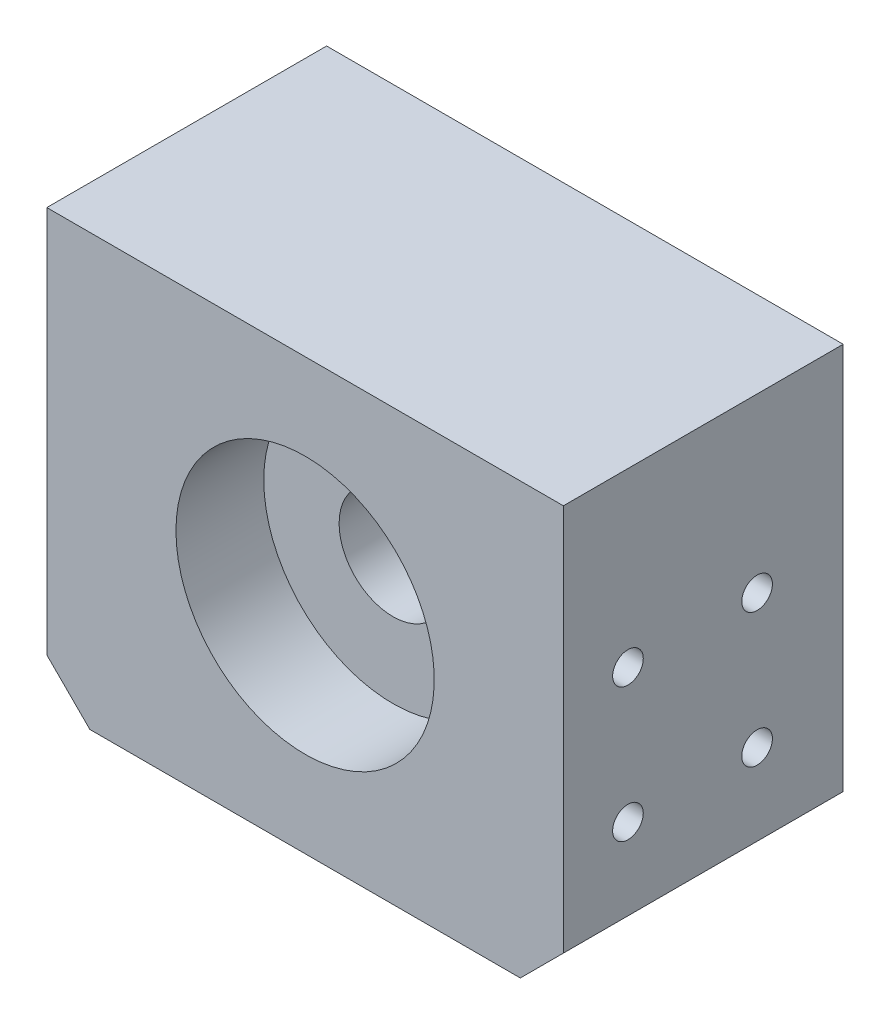
from build123d import *

# Parameters (mm, degrees)
SKETCH1_W                 = 38.1
SKETCH1_H                 = 31.75
BOSS_EXTRUDE1_DEPTH       = 20.6375
SKETCH2_R                 = 11.1125
CUT_EXTRUDE1_DEPTH        = 6.985
SKETCH3_R                 = 8.255
CUT_EXTRUDE2_DEPTH        = 2.413
SKETCH4_R                 = 3.96875
CUT_EXTRUDE3_DEPTH        = 28.225805502
CUT_EXTRUDE4_START        = -4.7625
SKETCH6_R                 = 9.525
CUT_EXTRUDE4_DEPTH        = 23.463305502
CHAMFER1_SIZE             = 3.175
F_4_40_TAPPED_HOLE2_D     = 2.2606
F_4_40_TAPPED_HOLE2_DEPTH = 7.62
F_4_40_TAPPED_HOLE2_TIP   = 0.679152758
F_4_40_TAPPED_HOLE1_D     = 2.2606
F_4_40_TAPPED_HOLE1_DEPTH = 7.62
F_4_40_TAPPED_HOLE1_TIP   = 0.679152758


with BuildPart() as part:
    # Sketch1 → Boss-Extrude1 (new body)
    with BuildSketch(Plane.XY):
        Rectangle(SKETCH1_W, SKETCH1_H)
    extrude(amount=BOSS_EXTRUDE1_DEPTH)

    # Sketch2 → Cut-Extrude1 (cut)
    with BuildSketch(Plane(origin=(0, 0, 0), x_dir=(-1, 0, 0), z_dir=(0, 0, -1))):
        Circle(SKETCH2_R)
    extrude(amount=-CUT_EXTRUDE1_DEPTH, mode=Mode.SUBTRACT)

    # Sketch3 → Cut-Extrude2 (cut)
    with BuildSketch(Plane(origin=(0, 0, 6.985), x_dir=(-1, 0, 0), z_dir=(0, 0, -1))):
        Circle(SKETCH3_R)
    extrude(amount=-CUT_EXTRUDE2_DEPTH, mode=Mode.SUBTRACT)

    # Sketch4 → Cut-Extrude3 (cut, through all)
    with BuildSketch(Plane(origin=(0, 0, 9.398), x_dir=(-1, 0, 0), z_dir=(0, 0, -1))):
        Circle(SKETCH4_R)
    extrude(amount=-CUT_EXTRUDE3_DEPTH, mode=Mode.SUBTRACT)

    # Sketch6 → Cut-Extrude4 (cut, through all)
    with BuildSketch(Plane(origin=(0, 0, 9.398), x_dir=(-1, 0, 0), z_dir=(0, 0, -1)).offset(CUT_EXTRUDE4_START)):
        Circle(SKETCH6_R)
    extrude(amount=-CUT_EXTRUDE4_DEPTH, mode=Mode.SUBTRACT)

    # Chamfer1
    chamfer1_edges = [part.edges().sort_by_distance(p)[0] for p in [
        (19.05, -15.875, 10.31875),
        (-19.05, -15.875, 10.31875),
    ]]
    chamfer(chamfer1_edges, length=CHAMFER1_SIZE)

    # #4-40 Tapped Hole2
    with Locations(Plane(origin=(-19.05, -28.277043901, 98.894849861), x_dir=(0, 0, 1), z_dir=(-1, 0, 0))):
        with Locations((-92.544849861, 31.452043901), (-83.019849861, 31.452043901), (-83.019849861, 21.927043901), (-92.544849861, 21.927043901)):
            Hole(F_4_40_TAPPED_HOLE2_D / 2, depth=F_4_40_TAPPED_HOLE2_DEPTH)
            with Locations((0, 0, -(F_4_40_TAPPED_HOLE2_DEPTH + F_4_40_TAPPED_HOLE2_TIP / 2))):  # 118° drill point
                Cone(0, F_4_40_TAPPED_HOLE2_D / 2, F_4_40_TAPPED_HOLE2_TIP, mode=Mode.SUBTRACT)

    # #4-40 Tapped Hole1
    with Locations(Plane(origin=(19.05, -28.277043901, 98.894849861), x_dir=(0, 0, -1), z_dir=(1, 0, 0))):
        with Locations((92.544849861, 31.452043901), (83.019849861, 31.452043901), (83.019849861, 21.57276521), (92.544849861, 21.57276521)):
            Hole(F_4_40_TAPPED_HOLE1_D / 2, depth=F_4_40_TAPPED_HOLE1_DEPTH)
            with Locations((0, 0, -(F_4_40_TAPPED_HOLE1_DEPTH + F_4_40_TAPPED_HOLE1_TIP / 2))):  # 118° drill point
                Cone(0, F_4_40_TAPPED_HOLE1_D / 2, F_4_40_TAPPED_HOLE1_TIP, mode=Mode.SUBTRACT)


solid = part.part
